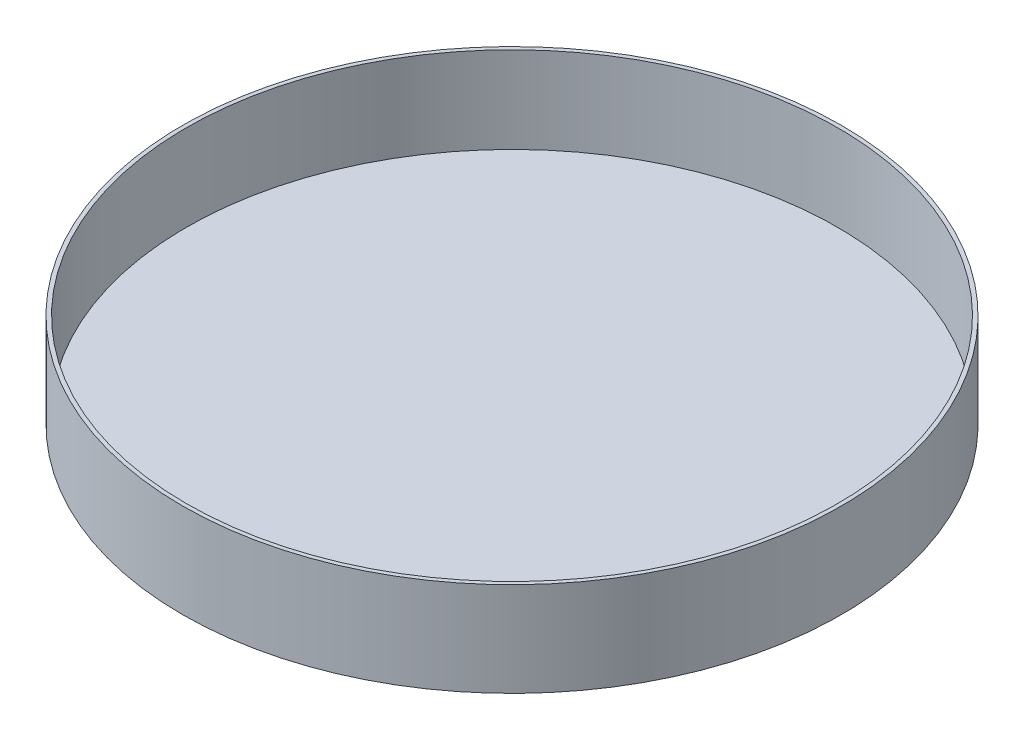
from build123d import *

# Parameters (mm, degrees)
SKETCH1_R           = 266.7
BOSS_EXTRUDE1_DEPTH = 76.2
SKETCH2_R           = 263.525
CUT_EXTRUDE1_DEPTH  = 69.85


with BuildPart() as part:
    # Sketch1 → Boss-Extrude1 (new body)
    with BuildSketch(Plane(origin=(0, 0, 0), x_dir=(1, 0, 0), z_dir=(0, 1, 0))):
        Circle(SKETCH1_R)
    extrude(amount=BOSS_EXTRUDE1_DEPTH)

    # Sketch2 → Cut-Extrude1 (cut)
    with BuildSketch(Plane(origin=(0, 76.2, 0), x_dir=(1, 0, 0), z_dir=(0, 1, 0))):
        Circle(SKETCH2_R)
    extrude(amount=-CUT_EXTRUDE1_DEPTH, mode=Mode.SUBTRACT)


solid = part.part
